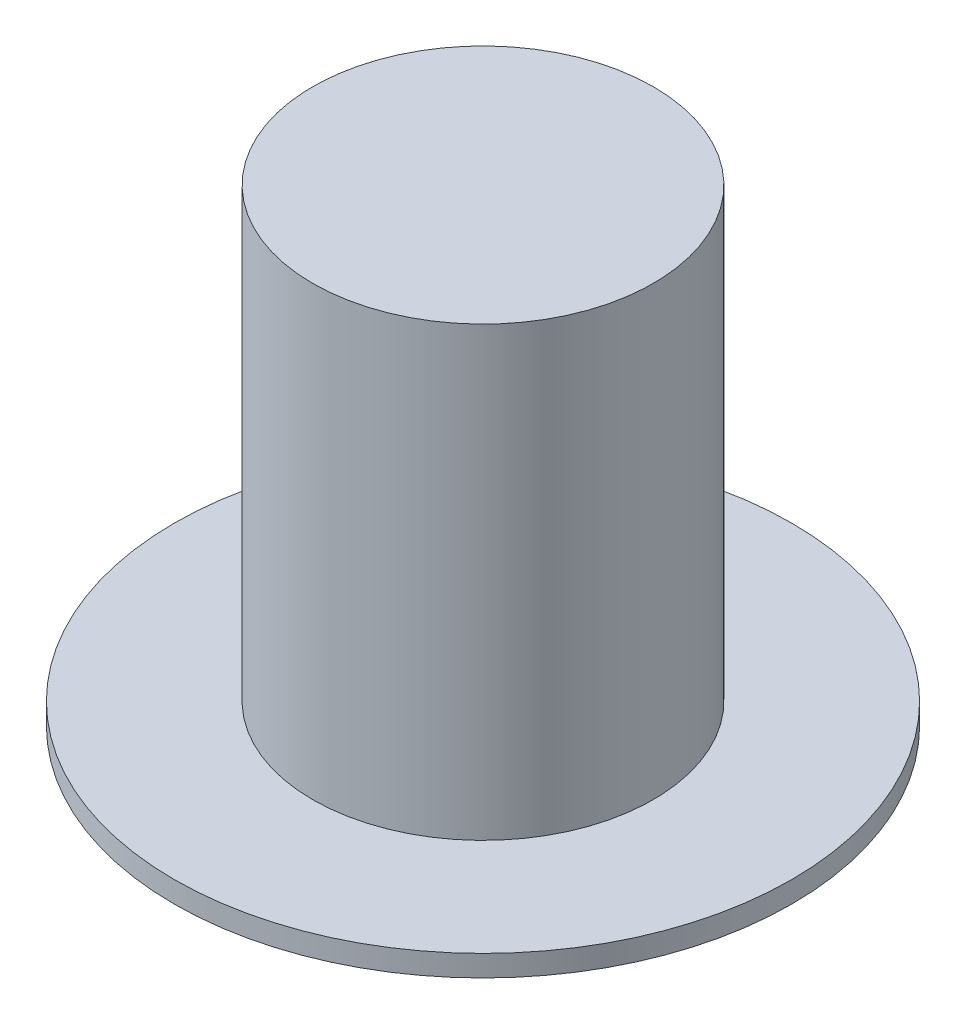
from build123d import *

# Parameters (mm, degrees)
SKETCH_1_R          = 14.5
EXTRUDE_1_DEPTH     = 1
SKETCH_3_R          = 8
EXTRUDE_3_DEPTH     = 21
SKETCH_4_W          = 2
SKETCH_4_H          = 13
CUT_EXTRUDE_1_DEPTH = 10
SKETCH_5_W          = 2
SKETCH_5_H          = 2
EXTRUDE_4_DEPTH     = 1


with BuildPart() as part:
    # 草图1 → 拉伸1 (new body)
    with BuildSketch(Plane(origin=(0, 0, 0), x_dir=(1, 0, 0), z_dir=(0, 1, 0))):
        Circle(SKETCH_1_R)
    extrude(amount=EXTRUDE_1_DEPTH)

    # 草图3 → 拉伸3 (add)
    with BuildSketch(Plane(origin=(0, 1, 0), x_dir=(-1, 0, 0), z_dir=(0, 1, 0))):
        Circle(SKETCH_3_R)
    extrude(amount=EXTRUDE_3_DEPTH)

    # 草图4 → 切除-拉伸1 (cut)
    with BuildSketch(Plane(origin=(0, 0, 0), x_dir=(-1, 0, 0), z_dir=(0, 1, 0))):
        Rectangle(SKETCH_4_W, SKETCH_4_H)
    extrude(amount=CUT_EXTRUDE_1_DEPTH, mode=Mode.SUBTRACT)

    # 草图5 → 拉伸4 (add)
    with BuildSketch(Plane.XZ.offset(-10)):
        Rectangle(SKETCH_5_W, SKETCH_5_H)
    extrude(amount=EXTRUDE_4_DEPTH)


solid = part.part
